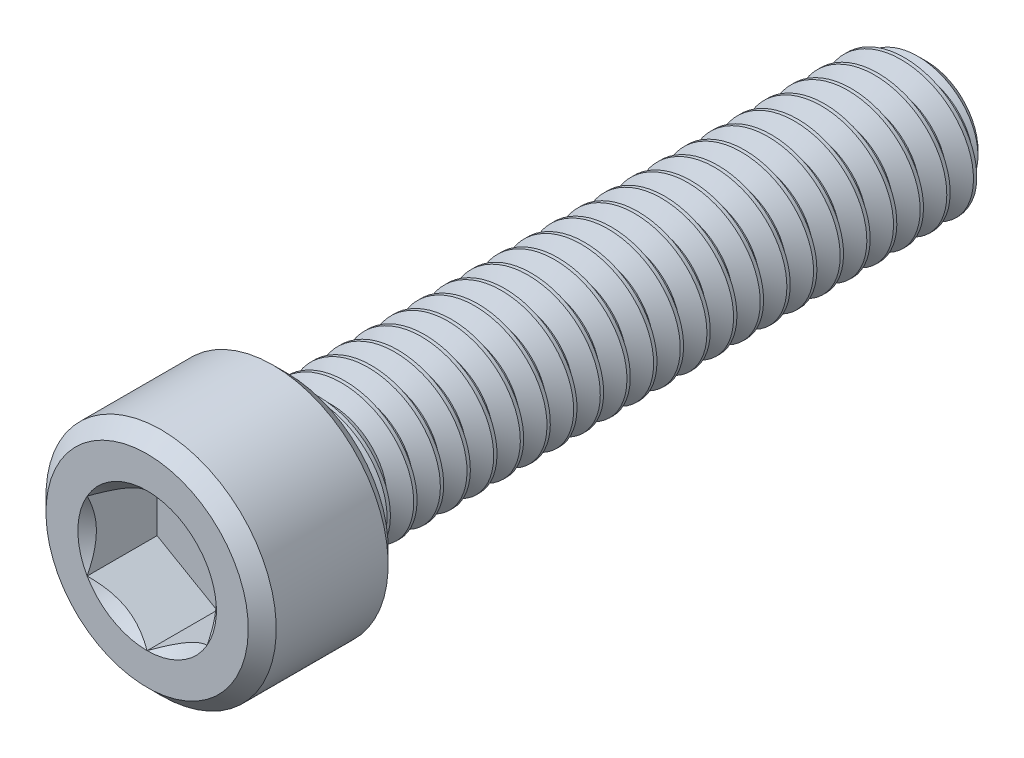
from build123d import *

# Parameters (mm, degrees)
CUT_EXTRUDE1_DEPTH = 2.0828
CUT_SWEEP1_PITCH   = 0.79375
CUT_SWEEP1_TO      = 19.05


with BuildPart() as part:
    # Sketch3 → Revolve1 (revolve)
    with BuildSketch(Plane(origin=(0, 0, 0), x_dir=(0, 0, -1), z_dir=(1, 0, 0))):
        Polygon((11.6078, 0), (-11.6078, 0), (-11.6078, 3.01244), (-11.19124, 3.429), (-7.85876, 3.429), (-7.4422, 3.01244), (-7.4422, 2.0828), (11.052175, 2.0828), (11.6078, 1.527175), align=None)
    revolve(axis=Axis((0, 0, -11.6078), (0, 0, 1)))

    # Sketch4 → Cut-Extrude1 (cut)
    with BuildSketch(Plane.XY.offset(11.6078)):
        Polygon((0, -2.062222993), (1.7859375, -1.031111496), (1.7859375, 1.031111496), (0, 2.062222993), (-1.7859375, 1.031111496), (-1.7859375, -1.031111496), align=None)
    extrude(amount=-CUT_EXTRUDE1_DEPTH, mode=Mode.SUBTRACT)

    # Cut-Extrude3 cone 1 section (through the dimple's axis) → Cut-Extrude3 (revolve, cut)
    with BuildSketch(Plane(origin=(0, 0, 11.6078), x_dir=(0, -1, 0), z_dir=(1, 0, 0))):
        Polygon((0, 0), (2.062222993, 0), (0, 2.062222993), align=None)
    revolve(axis=Axis((0, 0, 11.6078), (0, 0, -1)), mode=Mode.SUBTRACT)


with BuildPart() as body_2:
    # Split1: read off the stored shape, not the designer's step
    # Split1: the piece on the far side of the plane
    add(part.part)
    split(bisect_by=Plane.XY.offset(7.4422), keep=Keep.BOTTOM)

    # Cut-Sweep1: arcs per turn and ends read off the stored shape
    # Cut-Sweep1: the profile of Sketch7 screwed along a right-hand helix through 25 turns, 8 arcs to a turn; built about Z, then put on its axis
    cut_sweep1_z = Axis((0, 0, 0), (0, 0, 1))
    cut_sweep1_corners = [(2.125762979, 0, 0.024804687), (2.125762979, 0, -0.719335938), (1.567244252, 0, -0.396875), (1.567244252, 0, -0.29765625)]
    with BuildLine(mode=Mode.PRIVATE) as cut_sweep1_profile:
        Line(cut_sweep1_corners[0], cut_sweep1_corners[1])
        Line(cut_sweep1_corners[1], cut_sweep1_corners[2])
        Line(cut_sweep1_corners[2], cut_sweep1_corners[3])
        Line(cut_sweep1_corners[3], cut_sweep1_corners[0])
    cut_sweep1_cap = Face(cut_sweep1_profile.wire())
    cut_sweep1_turn_angles = [0, 22.5, 45, 67.5, 90, 112.5, 135, 157.5, 180, 202.5, 225, 247.5, 270, 292.5, 315, 337.5, 360]
    cut_sweep1_turn_weights = [1, 0.9238795325112867, 1, 0.9238795325112867, 1, 0.9238795325112867, 1, 0.9238795325112867, 1, 0.9238795325112867, 1, 0.9238795325112867, 1, 0.9238795325112867, 1, 0.9238795325112867, 1]
    cut_sweep1_turn_rails = [Edge.make_bspline([Vector(p[0], p[1], 0).rotate(cut_sweep1_z, cut_sweep1_turn_angles[k]) / cut_sweep1_turn_weights[k] + Vector(0, 0, p[2] + CUT_SWEEP1_PITCH * cut_sweep1_turn_angles[k] / 360) for k in range(17)], [0, 0, 0, 1, 1, 2, 2, 3, 3, 4, 4, 5, 5, 6, 6, 7, 7, 8, 8, 8], 2, cut_sweep1_turn_weights) for p in cut_sweep1_corners]
    cut_sweep1_turn_sides = [Face.make_surface_from_curves(cut_sweep1_turn_rails[p[0]], cut_sweep1_turn_rails[p[1]]) for p in [(0, 1), (1, 2), (2, 3), (3, 0)]]
    cut_sweep1 = Plane(origin=(0, 0, -11.6078), x_dir=(0, 1, 0), z_dir=(0, 0, 1)) * split(Solid(Shell([*[p.moved(Location((0, 0, CUT_SWEEP1_PITCH * i))) for i in range(25) for p in cut_sweep1_turn_sides], cut_sweep1_cap, cut_sweep1_cap.rotate(cut_sweep1_z, 9000).moved(Location((0, 0, CUT_SWEEP1_PITCH * 9000 / 360)))])), bisect_by=Plane.XY.offset(CUT_SWEEP1_TO), keep=Keep.BOTTOM, mode=Mode.PRIVATE)
    add(cut_sweep1, mode=Mode.SUBTRACT)


with BuildPart() as part_1:
    add(part.part)

    # Split1
    split(bisect_by=Plane.XY.offset(7.4422), keep=Keep.TOP)

    add(body_2.part)  # Boss-Extrude1 merges body 2
    # Boss-Extrude1: read off the stored shape, not the designer's step
    # Boss-Extrude1 outline → Boss-Extrude1 (revolve)
    with BuildSketch(Plane.XZ):
        Polygon((1.567243236, 7.4422), (1.567243236, 6.025719433), (2.0828, 7.4422), align=None)
    revolve(axis=Axis((0, 0, 0), (0, 0, 1)))


solid = part_1.part
